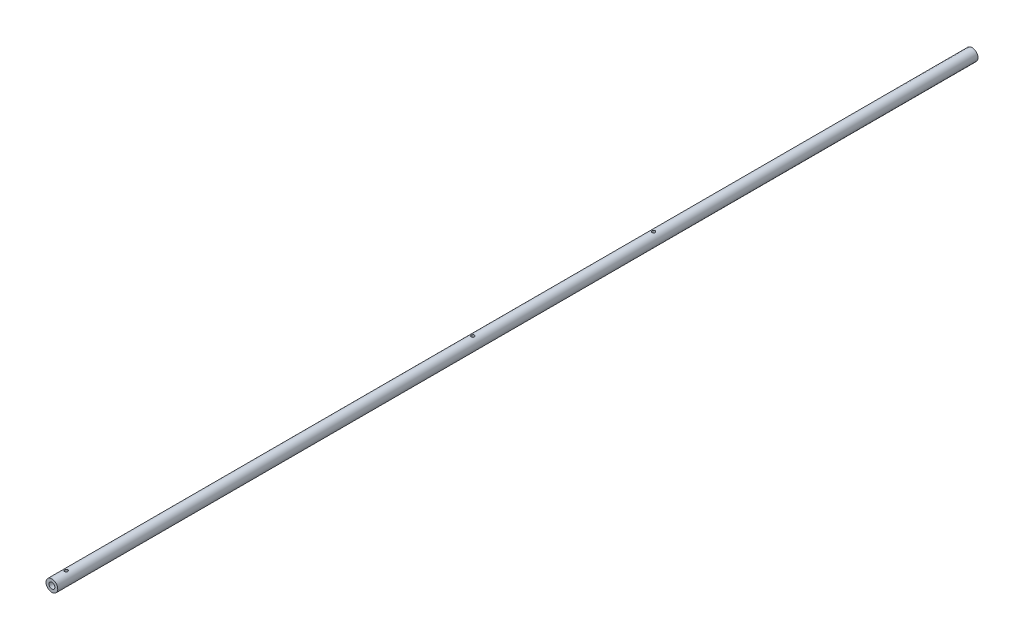
from build123d import *

# Parameters (mm, degrees)
SKETCH1_R        = 7.8613
SKETCH1_R_2      = 3.93065
ROD_DEPTH        = 1228.725
HOLES_DEPTH      = 1229.77529504
HOLES_DEPTH_BACK = 1229.77529504
SKETCH3_R        = 2.1082


with BuildPart() as part:
    # Sketch1 → Rod (new body)
    with BuildSketch(Plane.XY):
        Circle(SKETCH1_R)
        Circle(SKETCH1_R_2, mode=Mode.SUBTRACT)
    extrude(amount=ROD_DEPTH)

    # Sketch3 → Holes (cut, two sides: drawn at the far end of the back side and taken through both)
    with BuildSketch(Plane(origin=(0, 0, 0), x_dir=(1, 0, 0), z_dir=(0, 1, 0)).offset(-HOLES_DEPTH_BACK)):
        with Locations((0, -425.45)):
            Circle(SKETCH3_R)
        with Locations((0, -666.75)):
            Circle(SKETCH3_R)
        with Locations((0, -1209.675)):
            Circle(SKETCH3_R)
    extrude(amount=HOLES_DEPTH + HOLES_DEPTH_BACK, mode=Mode.SUBTRACT)


solid = part.part
